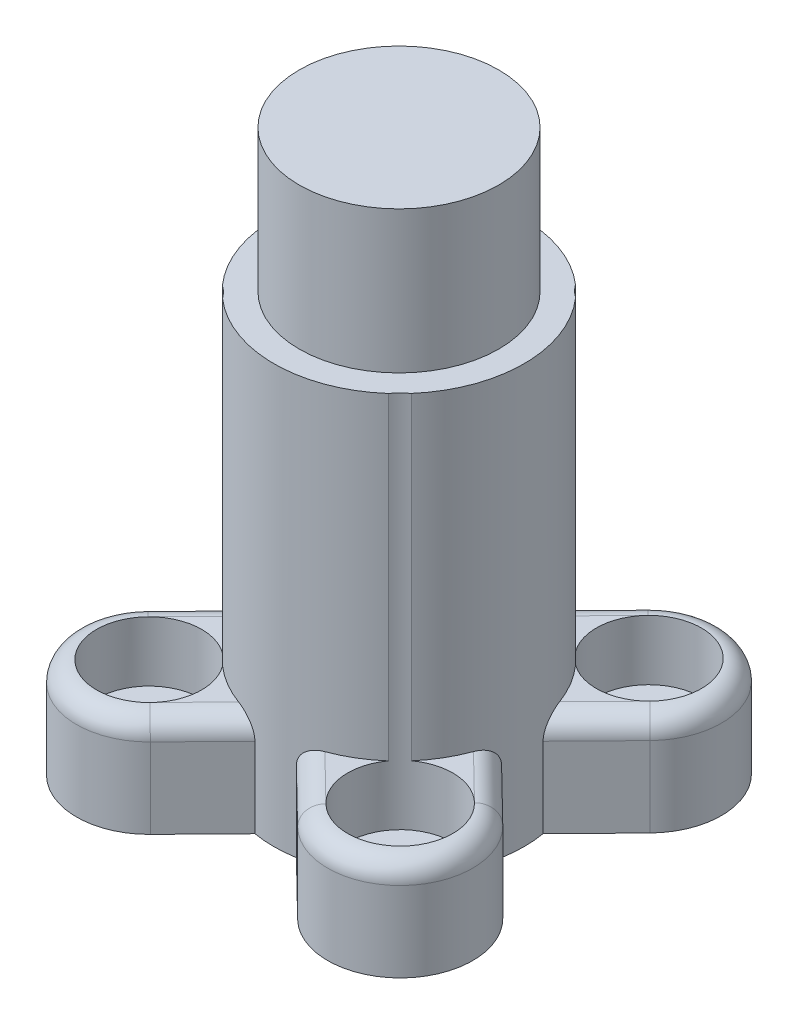
from build123d import *

# Parameters (mm, degrees)
SKETCH1_R                = 9.97
BOSS_EXTRUDE1_DEPTH      = 16
BOSS_EXTRUDE2_DEPTH      = 40
BOSS_EXTRUDE2_DEPTH_BACK = 1.8
SKETCH3_R                = 12.5
SHELL2_T                 = -4
BOSS_EXTRUDE3_DEPTH      = 10
SKETCH5_3_R              = 3.25
BOSS_EXTRUDE4_DEPTH      = 4
SKETCH7_R                = 5.25
CUT_EXTRUDE3_DEPTH       = 52
CIRPATTERN1_COUNT        = 4
FILLET1_R                = 2


with BuildPart() as part:
    # Sketch1 → Boss-Extrude1 (new body)
    with BuildSketch(Plane(origin=(0, 0, 0), x_dir=(1, 0, 0), z_dir=(0, 1, 0))):
        with Locations(Location((0, 0, 0), (0, 0, 270))):
            Circle(SKETCH1_R)
    extrude(amount=BOSS_EXTRUDE1_DEPTH)

    # Sketch3 → Boss-Extrude2 (add, two sides: drawn at the far end of the back side and taken through both)
    with BuildSketch(Plane.XZ.offset(-BOSS_EXTRUDE2_DEPTH_BACK)):
        with Locations(Location((0, 0, 0), (0, 0, 270))):
            Circle(SKETCH3_R)
    extrude(amount=BOSS_EXTRUDE2_DEPTH + BOSS_EXTRUDE2_DEPTH_BACK)

    # Shell2
    shell2_openings = [part.faces().sort_by_distance(p)[0] for p in [
        (0, -40, 0),
    ]]
    offset(amount=SHELL2_T, openings=shell2_openings, kind=Kind.INTERSECTION)

    # Sketch5 → Boss-Extrude3 (add)
    with BuildSketch(Plane.XZ.offset(40)):
        with BuildLine():
            Line((12.326784576, 2.073736248), (17.615054746, 7.242520906))
            ThreePointArc((17.615054746, 7.242520906), (17.731884341, 17.495224521), (7.479173432, 17.61141232))
            Line((7.479173432, 17.61141232), (2.073736248, 12.326784576))
            ThreePointArc((2.073736248, 12.326784576), (5.390423742, 11.278002123), (8.289664381, 9.355825161))
            ThreePointArc((8.289664381, 9.355825161), (10.933563593, 17.423072819), (17.797438623, 12.427283854))
            ThreePointArc((17.797438623, 12.427283854), (14.916299872, 7.74209481), (9.435154287, 8.199259941))
            ThreePointArc((9.435154287, 8.199259941), (11.30380493, 5.336102895), (12.326784576, 2.073736248))
        make_face()
    boss_extrude3 = extrude(amount=-BOSS_EXTRUDE3_DEPTH)

    # Sketch5<3> → Boss-Extrude4 (add)
    with BuildSketch(Plane.XZ.offset(40)):
        with BuildLine():
            ThreePointArc((8.289664381, 9.355825161), (8.881256104, 8.796208844), (9.435154287, 8.199259941))
            ThreePointArc((9.435154287, 8.199259941), (14.916299872, 7.74209481), (17.797438623, 12.427283854))
            ThreePointArc((17.797438623, 12.427283854), (10.933563593, 17.423072819), (8.289664381, 9.355825161))
        make_face()
        with Locations(Location((12.547438623, 12.427283854, 0), (0, 0, 270))):
            Circle(SKETCH5_3_R, mode=Mode.SUBTRACT)
    boss_extrude4 = extrude(amount=-BOSS_EXTRUDE4_DEPTH)

    # Sketch7 → Cut-Extrude3 (cut)
    with BuildSketch(Plane(origin=(0, -36, 0), x_dir=(1, 0, 0), z_dir=(0, 1, 0))):
        with Locations(Location((12.547438623, -12.427283854, 0), (0, 0, 90))):
            Circle(SKETCH7_R)
    cut_extrude3 = extrude(amount=CUT_EXTRUDE3_DEPTH, mode=Mode.SUBTRACT)

    # CirPattern1: Boss-Extrude3, Boss-Extrude4, Cut-Extrude3 ×4 about axis
    cirpattern1_axis = Axis((0, 0, 0), (0, 1, 0))
    add([boss_extrude3.rotate(cirpattern1_axis, i * 360 / CIRPATTERN1_COUNT) for i in range(1, CIRPATTERN1_COUNT)])
    add([boss_extrude4.rotate(cirpattern1_axis, i * 360 / CIRPATTERN1_COUNT) for i in range(1, CIRPATTERN1_COUNT)])
    add([cut_extrude3.rotate(cirpattern1_axis, i * 360 / CIRPATTERN1_COUNT) for i in range(1, CIRPATTERN1_COUNT)], mode=Mode.SUBTRACT)

    # Fillet1
    fillet1_edges = [part.edges().sort_by_distance(p)[0] for p in [
        (14.969098448, -30, -4.77645484),
        (17.495224521, -30, -17.731884341),
        (4.658128577, -30, -14.970919661),
        (4.77645484, -30, 14.969098448),
        (17.731884341, -30, 17.495224521),
        (14.970919661, -30, 4.658128577),
        (-14.969098448, -30, 4.77645484),
        (-17.495224521, -30, 17.731884341),
        (-4.658128577, -30, 14.970919661),
        (-4.77645484, -30, -14.969098448),
        (-17.731884341, -30, -17.495224521),
        (-14.970919661, -30, -4.658128577),
    ]]
    fillet(fillet1_edges, radius=FILLET1_R - 0.0001)  # a hair under: the kernel refuses the full size


solid = part.part
